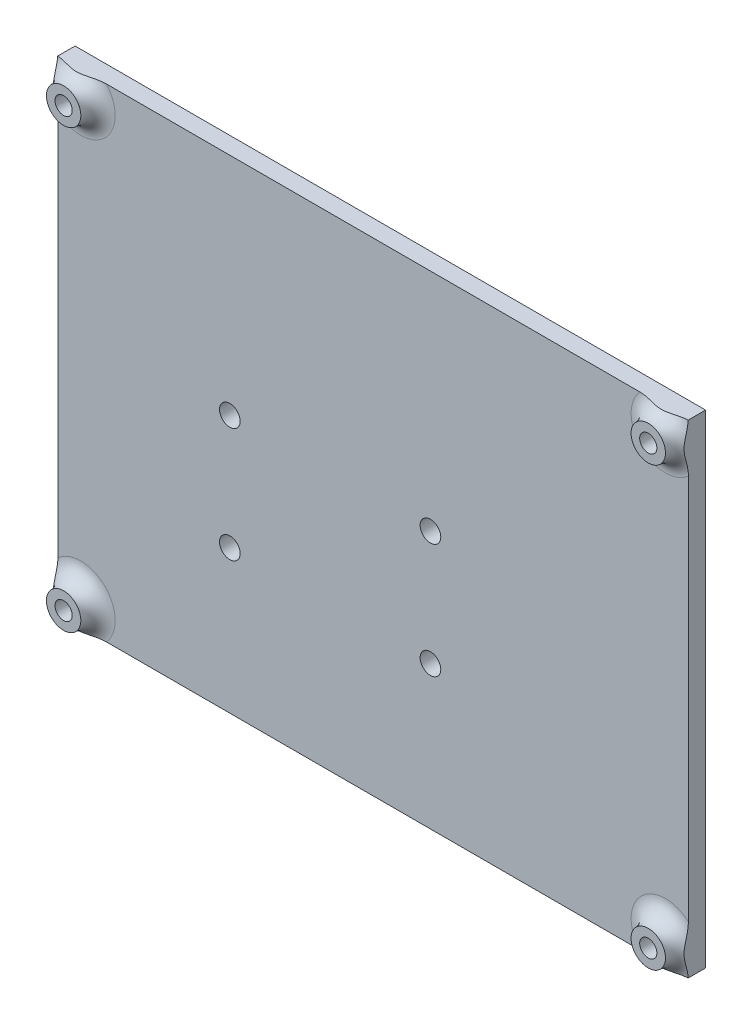
from build123d import *

# Parameters (mm, degrees)
SKETCH1_W           = 110
SKETCH1_H           = 84.3
SKETCH1_R           = 1.5
SKETCH1_R_2         = 1.8
BOSS_EXTRUDE1_DEPTH = 3
BOSS_EXTRUDE2_START = 3
SKETCH2_R           = 3
SKETCH2_R_2         = 1.5
BOSS_EXTRUDE2_DEPTH = 3
FILLET1_R           = 3


with BuildPart() as part:
    # Sketch1 → Boss-Extrude1 (new body)
    with BuildSketch(Plane.XY):
        Rectangle(SKETCH1_W, SKETCH1_H)
        with Locations((51, 38.15)):
            Circle(SKETCH1_R, mode=Mode.SUBTRACT)
        with Locations(Location((-51, 38.15, 0), (0, 0, 180))):
            Circle(SKETCH1_R, mode=Mode.SUBTRACT)
        with Locations(Location((51, -38.15, 0), (0, 0, 180))):
            Circle(SKETCH1_R, mode=Mode.SUBTRACT)
        with Locations((-51, -38.15)):
            Circle(SKETCH1_R, mode=Mode.SUBTRACT)
        with Locations((-25, -17.15)):
            Circle(SKETCH1_R_2, mode=Mode.SUBTRACT)
        with Locations((-25, 2.85)):
            Circle(SKETCH1_R_2, mode=Mode.SUBTRACT)
        with Locations((10, 2.85)):
            Circle(SKETCH1_R_2, mode=Mode.SUBTRACT)
        with Locations((10, -17.15)):
            Circle(SKETCH1_R_2, mode=Mode.SUBTRACT)
    extrude(amount=BOSS_EXTRUDE1_DEPTH)

    # Sketch2 → Boss-Extrude2 (add)
    # profile 1 of 4: a face of its own
    with BuildSketch(Plane.XY.offset(BOSS_EXTRUDE2_START)):
        with Locations(Location((-51, 38.15, 0), (0, 0, 180))):
            Circle(SKETCH2_R)
        with Locations(Location((-51, 38.15, 0), (0, 0, 180))):
            Circle(SKETCH2_R_2, mode=Mode.SUBTRACT)
    # profile 2 of 4: a face of its own
    with BuildSketch(Plane.XY.offset(BOSS_EXTRUDE2_START)):
        with Locations(Location((51, 38.15, 0), (0, 0, 180))):
            Circle(SKETCH2_R)
        with Locations(Location((51, 38.15, 0), (0, 0, 180))):
            Circle(SKETCH2_R_2, mode=Mode.SUBTRACT)
    # profile 3 of 4: a face of its own
    with BuildSketch(Plane.XY.offset(BOSS_EXTRUDE2_START)):
        with Locations(Location((51, -38.15, 0), (0, 0, 180))):
            Circle(SKETCH2_R)
        with Locations(Location((51, -38.15, 0), (0, 0, 180))):
            Circle(SKETCH2_R_2, mode=Mode.SUBTRACT)
    # profile 4 of 4: a face of its own
    with BuildSketch(Plane.XY.offset(BOSS_EXTRUDE2_START)):
        with Locations(Location((-51, -38.15, 0), (0, 0, 180))):
            Circle(SKETCH2_R)
        with Locations(Location((-51, -38.15, 0), (0, 0, 180))):
            Circle(SKETCH2_R_2, mode=Mode.SUBTRACT)
    extrude(amount=BOSS_EXTRUDE2_DEPTH)

    # Fillet1
    # the kernel refuses this fillet: 3 mm, written as the material it adds along each edge
    with BuildSketch(Plane(origin=(-51, 38.15, 3), x_dir=(-1, 0, 0), z_dir=(0, 1, 0))) as fillet1_piece_1_section:
        with BuildLine():
            CenterArc((3 + FILLET1_R, FILLET1_R), FILLET1_R, 180, 90)
            Line((3, FILLET1_R), (3, 0))
            Line((3, 0), (3 + FILLET1_R, 0))
        make_face()
    fillet1_piece_1 = revolve(axis=Axis((-51, 38.15, 3), (0, 0, 1)), mode=Mode.PRIVATE)
    fillet1_piece_1 = split(fillet1_piece_1, bisect_by=Plane(origin=(-55, 38.15, 3.853016367), z_dir=(1, 0, 0)), keep=Keep.TOP, mode=Mode.PRIVATE)
    fillet1_piece_1 = split(fillet1_piece_1, bisect_by=Plane(origin=(-47.146983633, 42.15, 3.853016367), z_dir=(0, -1, 0)), keep=Keep.TOP, mode=Mode.PRIVATE)
    add(fillet1_piece_1)
    with BuildSketch(Plane(origin=(51, 38.15, 3), x_dir=(-1, 0, 0), z_dir=(0, 1, 0))) as fillet1_piece_2_section:
        with BuildLine():
            CenterArc((3 + FILLET1_R, FILLET1_R), FILLET1_R, 180, 90)
            Line((3, FILLET1_R), (3, 0))
            Line((3, 0), (3 + FILLET1_R, 0))
        make_face()
    fillet1_piece_2 = revolve(axis=Axis((51, 38.15, 3), (0, 0, 1)), mode=Mode.PRIVATE)
    fillet1_piece_2 = split(fillet1_piece_2, bisect_by=Plane(origin=(55, 38.15, 3.853016383), z_dir=(-1, 0, 0)), keep=Keep.TOP, mode=Mode.PRIVATE)
    fillet1_piece_2 = split(fillet1_piece_2, bisect_by=Plane(origin=(54.853016383, 42.15, 3.853016383), z_dir=(0, -1, 0)), keep=Keep.TOP, mode=Mode.PRIVATE)
    add(fillet1_piece_2)
    with BuildSketch(Plane(origin=(51, -38.15, 3), x_dir=(-1, 0, 0), z_dir=(0, 1, 0))) as fillet1_piece_3_section:
        with BuildLine():
            CenterArc((3 + FILLET1_R, FILLET1_R), FILLET1_R, 180, 90)
            Line((3, FILLET1_R), (3, 0))
            Line((3, 0), (3 + FILLET1_R, 0))
        make_face()
    fillet1_piece_3 = revolve(axis=Axis((51, -38.15, 3), (0, 0, 1)), mode=Mode.PRIVATE)
    fillet1_piece_3 = split(fillet1_piece_3, bisect_by=Plane(origin=(54.853016382, -42.15, 3.853016382), z_dir=(0, 1, 0)), keep=Keep.TOP, mode=Mode.PRIVATE)
    fillet1_piece_3 = split(fillet1_piece_3, bisect_by=Plane(origin=(55, -38.15, 3.853016382), z_dir=(-1, 0, 0)), keep=Keep.TOP, mode=Mode.PRIVATE)
    add(fillet1_piece_3)
    with BuildSketch(Plane(origin=(-51, -38.15, 3), x_dir=(-1, 0, 0), z_dir=(0, 1, 0))) as fillet1_piece_4_section:
        with BuildLine():
            CenterArc((3 + FILLET1_R, FILLET1_R), FILLET1_R, 180, 90)
            Line((3, FILLET1_R), (3, 0))
            Line((3, 0), (3 + FILLET1_R, 0))
        make_face()
    fillet1_piece_4 = revolve(axis=Axis((-51, -38.15, 3), (0, 0, 1)), mode=Mode.PRIVATE)
    fillet1_piece_4 = split(fillet1_piece_4, bisect_by=Plane(origin=(-47.146983624, -42.15, 3.853016376), z_dir=(0, 1, 0)), keep=Keep.TOP, mode=Mode.PRIVATE)
    fillet1_piece_4 = split(fillet1_piece_4, bisect_by=Plane(origin=(-55, -38.15, 3.853016376), z_dir=(1, 0, 0)), keep=Keep.TOP, mode=Mode.PRIVATE)
    add(fillet1_piece_4)


solid = part.part
